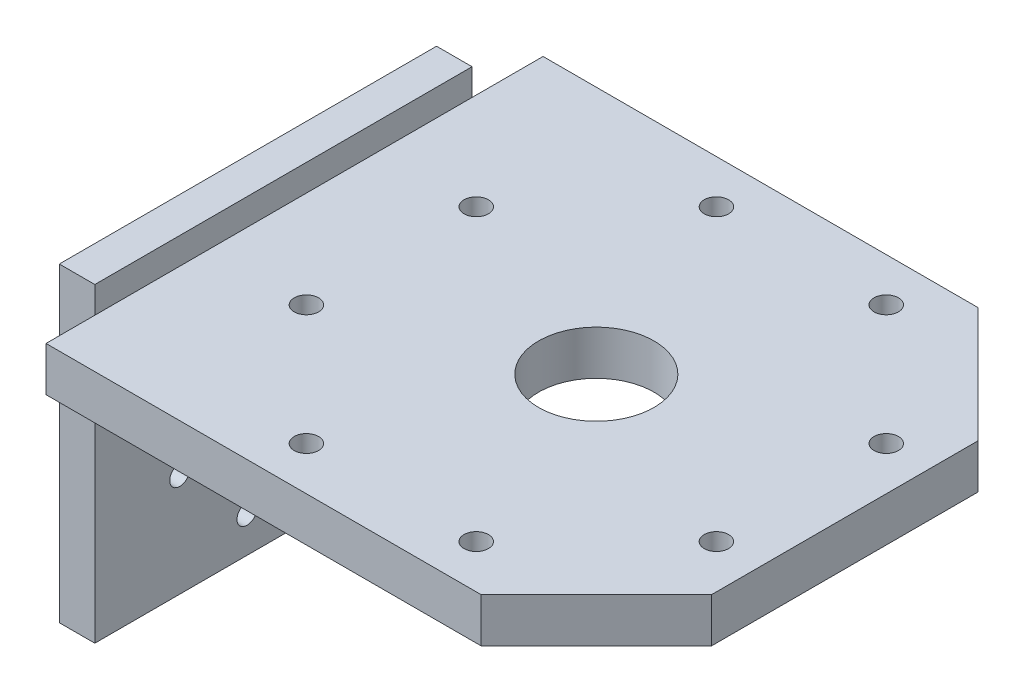
from build123d import *

# Parameters (mm, degrees)
SK_BACK_PLATE_W         = 85
SK_BACK_PLATE_H         = 70
SK_BACK_PLATE_R         = 2.25
SK_BACK_PLATE_R_2       = 6
BACK_PLATE_DEPTH        = 8
SK_ROLL_PILOT_RECESS_R  = 22.15
ROLL_PILOT_RECESS_DEPTH = 2.2
SK_MEDIAL_PLATE_R       = 2.75
SK_MEDIAL_PLATE_R_2     = 13
MEDIAL_PLATE_DEPTH      = 10


with BuildPart() as part:
    # SK_Back_Plate → Back_Plate (new body)
    with BuildSketch(Plane(origin=(-76, 0, 0), x_dir=(0, 0, -1), z_dir=(1, 0, 0))):
        with Locations((-2.5, 1)):
            Rectangle(SK_BACK_PLATE_W, SK_BACK_PLATE_H)
        with Locations((25.86862691, -10.715136106)):
            Circle(SK_BACK_PLATE_R, mode=Mode.SUBTRACT)
        with Locations((10.715136106, -25.86862691)):
            Circle(SK_BACK_PLATE_R, mode=Mode.SUBTRACT)
        with Locations((-10.715136106, -25.86862691)):
            Circle(SK_BACK_PLATE_R, mode=Mode.SUBTRACT)
        with Locations((-25.86862691, -10.715136106)):
            Circle(SK_BACK_PLATE_R, mode=Mode.SUBTRACT)
        with Locations((-25.86862691, 10.715136106)):
            Circle(SK_BACK_PLATE_R, mode=Mode.SUBTRACT)
        with Locations((-10.715136106, 25.86862691)):
            Circle(SK_BACK_PLATE_R, mode=Mode.SUBTRACT)
        with Locations((10.715136106, 25.86862691)):
            Circle(SK_BACK_PLATE_R, mode=Mode.SUBTRACT)
        with Locations((25.86862691, 10.715136106)):
            Circle(SK_BACK_PLATE_R, mode=Mode.SUBTRACT)
        Circle(SK_BACK_PLATE_R_2, mode=Mode.SUBTRACT)
    extrude(amount=BACK_PLATE_DEPTH)

    # SK_Roll_Pilot_Recess → Roll_Pilot_Recess (cut)
    with BuildSketch(Plane(origin=(-76, 0, 0), x_dir=(0, 0, -1), z_dir=(1, 0, 0))):
        Circle(SK_ROLL_PILOT_RECESS_R)
    extrude(amount=ROLL_PILOT_RECESS_DEPTH, mode=Mode.SUBTRACT)

    # SK_Medial_Plate → Medial_Plate (add)
    with BuildSketch(Plane(origin=(0, 20, 0), x_dir=(1, 0, 0), z_dir=(0, 1, 0))):
        Polygon((-68, 56), (30, 56), (56, 30), (56, -30), (30, -56), (-68, -56), align=None)
        with Locations((46.193976626, 19.134171618)):
            Circle(SK_MEDIAL_PLATE_R, mode=Mode.SUBTRACT)
        with Locations((19.134171618, 46.193976626)):
            Circle(SK_MEDIAL_PLATE_R, mode=Mode.SUBTRACT)
        with Locations((-19.134171618, 46.193976626)):
            Circle(SK_MEDIAL_PLATE_R, mode=Mode.SUBTRACT)
        with Locations((-46.193976626, 19.134171618)):
            Circle(SK_MEDIAL_PLATE_R, mode=Mode.SUBTRACT)
        with Locations((-46.193976626, -19.134171618)):
            Circle(SK_MEDIAL_PLATE_R, mode=Mode.SUBTRACT)
        with Locations((-19.134171618, -46.193976626)):
            Circle(SK_MEDIAL_PLATE_R, mode=Mode.SUBTRACT)
        with Locations((19.134171618, -46.193976626)):
            Circle(SK_MEDIAL_PLATE_R, mode=Mode.SUBTRACT)
        with Locations((46.193976626, -19.134171618)):
            Circle(SK_MEDIAL_PLATE_R, mode=Mode.SUBTRACT)
        Circle(SK_MEDIAL_PLATE_R_2, mode=Mode.SUBTRACT)
    extrude(amount=MEDIAL_PLATE_DEPTH)


solid = part.part
